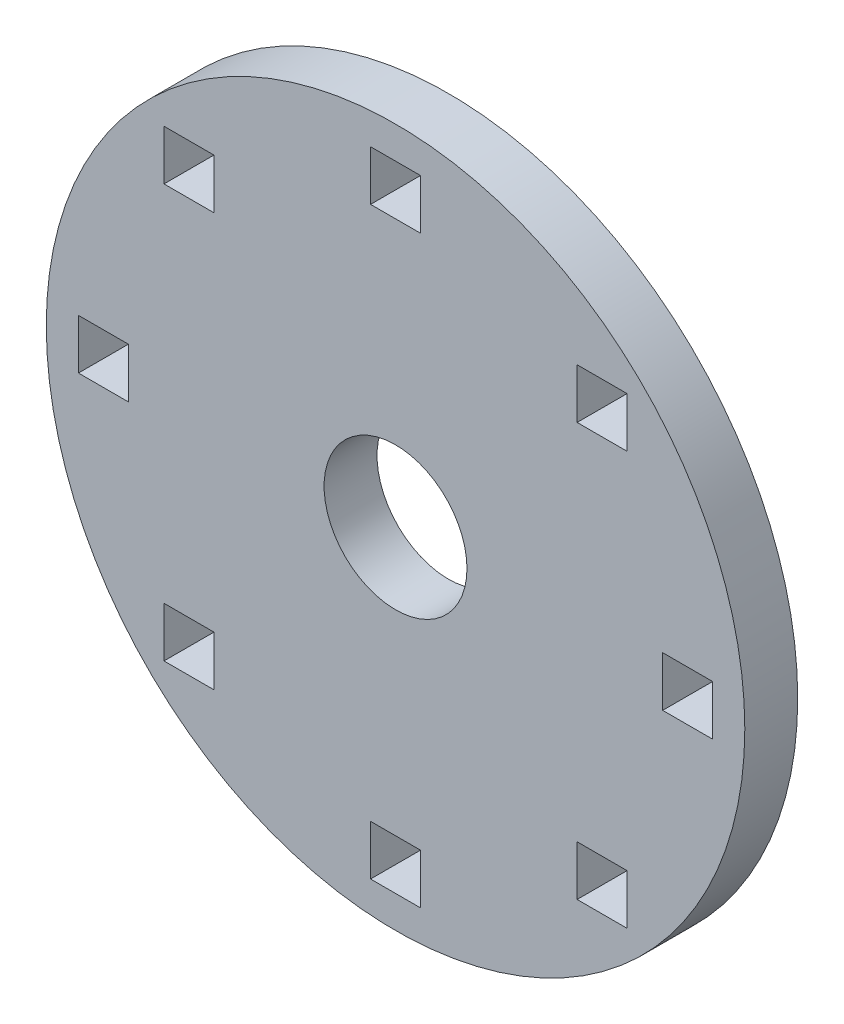
from build123d import *

# Parameters (mm, degrees)
SKETCH1_R              = 20.955
SKETCH1_W              = 2.9972
SKETCH1_H              = 2.9972
BOSS_EXTRUDE1_DEPTH    = 3.175
CUT_EXTRUDE1_OUTLINE_R = 4.28625
CUT_EXTRUDE1_DEPTH     = 3.175


# Read off the part's stored shape, not the designer's step: Cut-Extrude1
with BuildPart() as part:
    # Sketch1 → Boss-Extrude1 (new body)
    with BuildSketch(Plane.XY):
        Circle(SKETCH1_R)
        with Locations((0, 17.526)):
            Rectangle(SKETCH1_W, SKETCH1_H, mode=Mode.SUBTRACT)
        with Locations((0, -17.526)):
            Rectangle(SKETCH1_W, SKETCH1_H, mode=Mode.SUBTRACT)
        with Locations((-17.526, 0)):
            Rectangle(SKETCH1_W, SKETCH1_H, mode=Mode.SUBTRACT)
        with Locations((17.526, 0)):
            Rectangle(SKETCH1_W, SKETCH1_H, mode=Mode.SUBTRACT)
        with Locations((-12.392753447, 12.392753447)):
            Rectangle(SKETCH1_W, SKETCH1_H, mode=Mode.SUBTRACT)
        with Locations((12.392753447, 12.392753447)):
            Rectangle(SKETCH1_W, SKETCH1_H, mode=Mode.SUBTRACT)
        with Locations((-12.392753447, -12.392753447)):
            Rectangle(SKETCH1_W, SKETCH1_H, mode=Mode.SUBTRACT)
        with Locations((12.392753447, -12.392753447)):
            Rectangle(SKETCH1_W, SKETCH1_H, mode=Mode.SUBTRACT)
    extrude(amount=BOSS_EXTRUDE1_DEPTH)

    # Cut-Extrude1 outline → Cut-Extrude1 (cut)
    with BuildSketch(Plane.XY):
        Circle(CUT_EXTRUDE1_OUTLINE_R)
    extrude(amount=CUT_EXTRUDE1_DEPTH, mode=Mode.SUBTRACT)


solid = part.part
